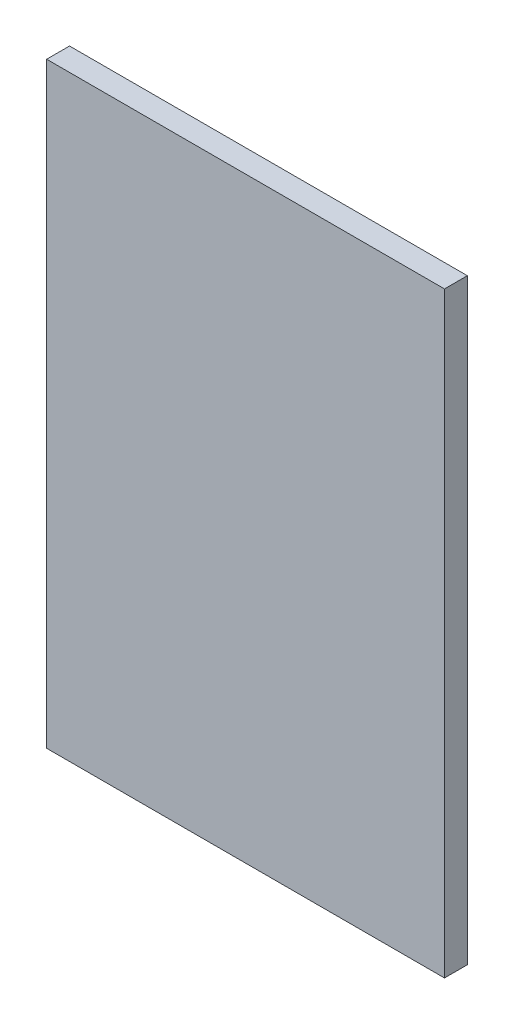
from build123d import *

# Parameters (mm, degrees)
SKETCH1_W           = 50.8
SKETCH1_H           = 76.2
BOSS_EXTRUDE1_DEPTH = 2.921


with BuildPart() as part:
    # Sketch1 → Boss-Extrude1 (new body)
    with BuildSketch(Plane.XY):
        with Locations((25.4, 38.1)):
            Rectangle(SKETCH1_W, SKETCH1_H)
    extrude(amount=-BOSS_EXTRUDE1_DEPTH)


solid = part.part
